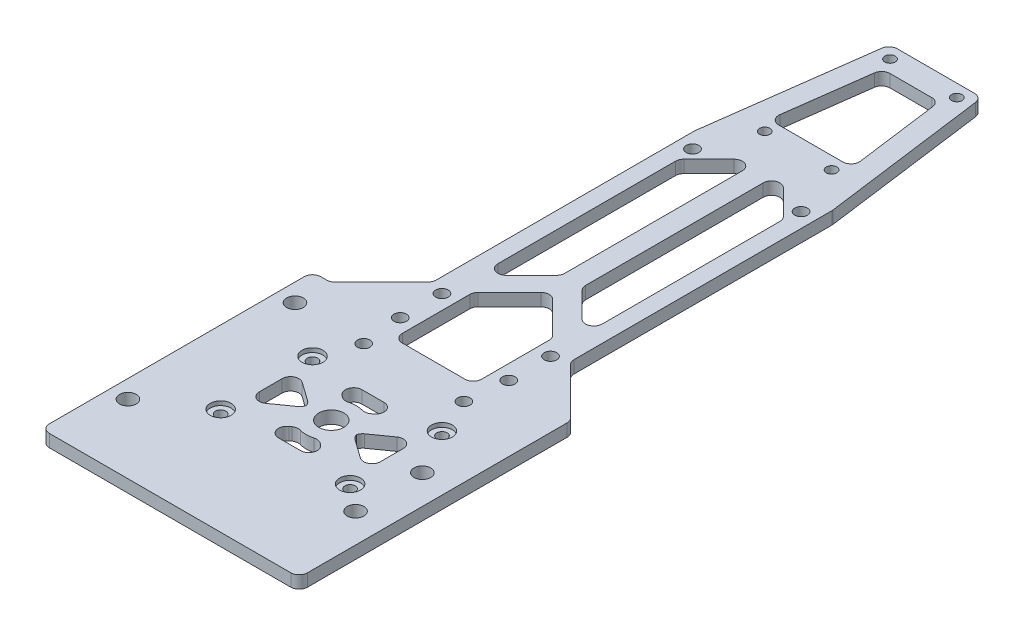
from build123d import *

# Parameters (mm, degrees)
SKETCH_1_R          = 1.25
SKETCH_1_R_2        = 1.5
EXTRUDE_1_DEPTH     = 3
CUT_EXTRUDE_1_DEPTH = 10
FILLET_1_R          = 2
SKETCH_3_R          = 2
CUT_EXTRUDE_2_DEPTH = 185.303255533
SKETCH_5_R          = 1.25
CUT_EXTRUDE_3_DEPTH = 185.303255533
SKETCH_6_R          = 3
CUT_EXTRUDE_4_DEPTH = 10
SKETCH_7_R          = 2.5
CUT_EXTRUDE_5_DEPTH = 1
FILLET_2_R          = 2
SKETCH_8_R          = 1.5
CUT_EXTRUDE_6_DEPTH = 10


with BuildPart() as part:
    # 草图1 → 凸台-拉伸1 (new body)
    with BuildSketch(Plane(origin=(0, 0, 0), x_dir=(1, 0, 0), z_dir=(0, 1, 0))):
        Polygon((11, 0), (-11, 0), (-16.5, -41.3), (-16.5, -104), (-28.8, -116.3), (-33, -116.3), (-33, -181.3), (28.8, -181.3), (28.8, -120.3), (28.8, -116.3), (16.5, -104), (16.5, -41.3), align=None)
        with Locations(Location((-8, -3, 0), (0, 0, 270))):
            Circle(SKETCH_1_R, mode=Mode.SUBTRACT)
        with Locations(Location((-8, -33, 0), (0, 0, 270))):
            Circle(SKETCH_1_R, mode=Mode.SUBTRACT)
        with Locations(Location((8, -33, 0), (0, 0, 90))):
            Circle(SKETCH_1_R, mode=Mode.SUBTRACT)
        with Locations(Location((8, -3, 0), (0, 0, 90))):
            Circle(SKETCH_1_R, mode=Mode.SUBTRACT)
        with Locations(Location((-13, -45.3, 0), (0, 0, 270))):
            Circle(SKETCH_1_R_2, mode=Mode.SUBTRACT)
        with Locations(Location((-13, -105.3, 0), (0, 0, 270))):
            Circle(SKETCH_1_R_2, mode=Mode.SUBTRACT)
        with Locations(Location((-13, -115.3, 0), (0, 0, 270))):
            Circle(SKETCH_1_R_2, mode=Mode.SUBTRACT)
        with Locations(Location((13, -115.3, 0), (0, 0, 90))):
            Circle(SKETCH_1_R_2, mode=Mode.SUBTRACT)
        with Locations(Location((13, -105.3, 0), (0, 0, 90))):
            Circle(SKETCH_1_R_2, mode=Mode.SUBTRACT)
        with Locations(Location((13, -45.3, 0), (0, 0, 90))):
            Circle(SKETCH_1_R_2, mode=Mode.SUBTRACT)
    extrude(amount=EXTRUDE_1_DEPTH)

    # 草图2 → 切除-拉伸1 (cut)
    with BuildSketch(Plane(origin=(0, 3, 0), x_dir=(1, 0, 0), z_dir=(0, 1, 0))):
        Polygon((6.754889433, -6), (-6.754889433, -6), (-9.951015341, -30), (9.951015341, -30), align=None)
        Polygon((12.5, -97.228932188), (2.5, -87.228932188), (2.5, -39.042640687), (12.5, -49.042640687), align=None)
        Polygon((-12.5, -49.042640687), (-2.5, -39.042640687), (-2.5, -87.228932188), (-12.5, -97.228932188), align=None)
        Polygon((-9.5, -101.3), (0, -91.8), (9.5, -101.3), (9.5, -120.3), (-9.5, -120.3), align=None)
    extrude(amount=-CUT_EXTRUDE_1_DEPTH, mode=Mode.SUBTRACT)

    # 圆角1
    fillet_1_edges = [part.edges().sort_by_distance(p)[0] for p in [
        (-9.951015341, 1.5, 30),
        (-6.754889433, 1.5, 6),
        (6.754889433, 1.5, 6),
        (9.951015341, 1.5, 30),
        (0, 1.5, 91.8),
        (9.5, 1.5, 101.3),
        (9.5, 1.5, 120.3),
        (-9.5, 1.5, 120.3),
        (-9.5, 1.5, 101.3),
        (12.5, 1.5, 49.042640687),
        (12.5, 1.5, 97.228932188),
        (2.5, 1.5, 87.228932188),
        (2.5, 1.5, 39.042640687),
        (-12.5, 1.5, 97.228932188),
        (-12.5, 1.5, 49.042640687),
        (-2.5, 1.5, 39.042640687),
        (-2.5, 1.5, 87.228932188),
        (-11, 1.5, 0),
        (11, 1.5, 0),
        (16.5, 1.5, 41.3),
        (16.5, 1.5, 104),
        (28.8, 1.5, 116.3),
        (28.8, 1.5, 181.3),
        (-33, 1.5, 181.3),
        (-33, 1.5, 116.3),
        (-28.8, 1.5, 116.3),
        (-16.5, 1.5, 104),
        (-16.5, 1.5, 41.3),
    ]]
    fillet(fillet_1_edges, radius=FILLET_1_R)

    # 草图3 → 切除-拉伸2 (cut, through all)
    with BuildSketch(Plane.XZ):
        with Locations(Location((-28.7, 164.8, 0), (0, 0, 270))):
            Circle(SKETCH_3_R)
        with Locations(Location((-28.7, 124.8, 0), (0, 0, 270))):
            Circle(SKETCH_3_R)
        with Locations(Location((21.8, 160.8, 0), (0, 0, 270))):
            Circle(SKETCH_3_R)
        with Locations(Location((21.8, 144.8, 0), (0, 0, 270))):
            Circle(SKETCH_3_R)
    extrude(amount=-CUT_EXTRUDE_2_DEPTH, mode=Mode.SUBTRACT)

    # 草图5 → 切除-拉伸3 (cut, through all)
    with BuildSketch(Plane(origin=(0, 3, 0), x_dir=(1, 0, 0), z_dir=(0, 1, 0))):
        with Locations(Location((15.5, -133.8, 0), (0, 0, 270))):
            Circle(SKETCH_5_R)
        with Locations(Location((-15.5, -133.8, 0), (0, 0, 270))):
            Circle(SKETCH_5_R)
        with Locations(Location((-15.5, -155.8, 0), (0, 0, 270))):
            Circle(SKETCH_5_R)
        with Locations(Location((15.5, -155.8, 0), (0, 0, 270))):
            Circle(SKETCH_5_R)
    extrude(amount=-CUT_EXTRUDE_3_DEPTH, mode=Mode.SUBTRACT)

    # 草图6 → 切除-拉伸4 (cut)
    with BuildSketch(Plane(origin=(0, 3, 0), x_dir=(1, 0, 0), z_dir=(0, 1, 0))):
        with BuildLine():
            Line((8.907296961, -134.8), (-8.907296961, -134.8))
            Line((-8.907296961, -134.8), (-2.501258408, -139.346220909))
            ThreePointArc((-2.501258408, -139.346220909), (0, -138.8), (2.501258408, -139.346220909))
            Line((2.501258408, -139.346220909), (8.907296961, -134.8))
        make_face()
        with BuildLine():
            Line((14.5, -151.411630102), (14.5, -138.188369898))
            Line((14.5, -138.188369898), (5.973740444, -144.239263777))
            ThreePointArc((5.973740444, -144.239263777), (5.993431516, -144.51932462), (6, -144.8))
            ThreePointArc((6, -144.8), (5.993431516, -145.08067538), (5.973740444, -145.360736223))
            Line((5.973740444, -145.360736223), (14.5, -151.411630102))
        make_face()
        with BuildLine():
            Line((-2.501258408, -150.253779091), (-8.907296961, -154.8))
            Line((-8.907296961, -154.8), (8.907296961, -154.8))
            Line((8.907296961, -154.8), (2.501258408, -150.253779091))
            ThreePointArc((2.501258408, -150.253779091), (0, -150.8), (-2.501258408, -150.253779091))
        make_face()
        with BuildLine():
            Line((-5.973740444, -144.239263777), (-14.5, -138.188369898))
            Line((-14.5, -138.188369898), (-14.5, -151.411630102))
            Line((-14.5, -151.411630102), (-5.973740444, -145.360736223))
            ThreePointArc((-5.973740444, -145.360736223), (-6, -144.8), (-5.973740444, -144.239263777))
        make_face()
        with Locations(Location((0, -144.8, 0), (0, 0, 270))):
            Circle(SKETCH_6_R)
    extrude(amount=-CUT_EXTRUDE_4_DEPTH, mode=Mode.SUBTRACT)

    # 草图7 → 切除-拉伸5 (cut)
    with BuildSketch(Plane(origin=(0, 3, 0), x_dir=(1, 0, 0), z_dir=(0, 1, 0))):
        with Locations(Location((15.5, -133.8, 0), (0, 0, 270))):
            Circle(SKETCH_7_R)
        with Locations(Location((-15.5, -133.8, 0), (0, 0, 270))):
            Circle(SKETCH_7_R)
        with Locations(Location((-15.5, -155.8, 0), (0, 0, 270))):
            Circle(SKETCH_7_R)
        with Locations(Location((15.5, -155.8, 0), (0, 0, 270))):
            Circle(SKETCH_7_R)
    extrude(amount=-CUT_EXTRUDE_5_DEPTH, mode=Mode.SUBTRACT)

    # 圆角2
    # the kernel refuses this fillet: 2 mm, written as the material it adds along each edge
    with BuildSketch(Plane(origin=(-2.501258408, 3, 150.253779091), x_dir=(-0.8155071447352907, 0, 0.5787470059410188), z_dir=(0, -1, 0)), Plane(origin=(5.973740444, 3, 145.360736223), x_dir=(0.8155071447351953, 0, 0.5787470059411531), z_dir=(0, -1, 0)), Plane(origin=(-5.973740444, 3, 144.239263777), x_dir=(-0.8155071447351933, 0, -0.578747005941156), z_dir=(0, -1, 0)), Plane(origin=(2.501258408, 3, 139.346220909), x_dir=(0.8155071447352105, 0, -0.5787470059411318), z_dir=(0, -1, 0))) as fillet_2_piece_1:
        with BuildLine():
            CenterArc((1.048845576, -2), FILLET_2_R, 90, 51.317812547)
            ThreePointArc((-0.512403924, -0.75), (-0.241988966, -0.384710393), (0, 0))
            Line((0, 0), (1.048845576, 0))
        make_face()
    extrude(amount=3)
    with BuildSketch(Plane(origin=(2.501258408, 3, 150.253779091), x_dir=(0.8155071447352289, 0, 0.578747005941106), z_dir=(0, -1, 0)), Plane(origin=(5.973740444, 3, 144.239263777), x_dir=(0.815507144735187, 0, -0.5787470059411648), z_dir=(0, -1, 0)), Plane(origin=(-5.973740444, 3, 145.360736223), x_dir=(-0.8155071447352036, 0, 0.5787470059411416), z_dir=(0, -1, 0)), Plane(origin=(-2.501258408, 3, 139.346220909), x_dir=(-0.8155071447352954, 0, -0.5787470059410122), z_dir=(0, -1, 0))) as fillet_2_piece_2:
        with BuildLine():
            CenterArc((1.048845576, 2), FILLET_2_R, 218.682187453, 51.317812547)
            ThreePointArc((-0.512403924, 0.75), (-0.241988966, 0.384710393), (0, 0))
            Line((0, 0), (1.048845576, 0))
        make_face()
    extrude(amount=3)
    with BuildSketch(Plane(origin=(8.907296961, 3, 154.8), x_dir=(-1, 0, 0), z_dir=(0, -1, 0)), Plane(origin=(-8.907296961, 3, 154.8), x_dir=(0.8155071447352168, 0, -0.578747005941123), z_dir=(0, -1, 0)), Plane(origin=(-8.907296961, 3, 134.8), x_dir=(1, 0, 0), z_dir=(0, -1, 0)), Plane(origin=(8.907296961, 3, 134.8), x_dir=(-0.815507144735218, 0, 0.5787470059411214), z_dir=(0, -1, 0))) as fillet_2_piece_3:
        with BuildLine():
            CenterArc((FILLET_2_R * 3.13696161898, FILLET_2_R), FILLET_2_R, 125.362461887, 144.637538113)
            Line((FILLET_2_R * 2.55821461304, FILLET_2_R * 1.81550714474), (0, 0))
            Line((0, 0), (FILLET_2_R * 3.13696161898, 0))
        make_face()
    extrude(amount=3)
    with BuildSketch(Plane(origin=(14.5, 3, 138.188369898), x_dir=(0, 0, 1), z_dir=(0, -1, 0)), Plane(origin=(14.5, 3, 151.411630102), x_dir=(-0.8155071447352171, 0, -0.5787470059411224), z_dir=(0, -1, 0)), Plane(origin=(-14.5, 3, 151.411630102), x_dir=(0, 0, -1), z_dir=(0, -1, 0)), Plane(origin=(-14.5, 3, 138.188369898), x_dir=(0.8155071447352167, 0, 0.578747005941123), z_dir=(0, -1, 0))) as fillet_2_piece_4:
        with BuildLine():
            CenterArc((FILLET_2_R * 1.93590824573, FILLET_2_R), FILLET_2_R, 144.637538113, 125.362461887)
            Line((FILLET_2_R * 1.12040110099, FILLET_2_R * 1.57874700594), (0, 0))
            Line((0, 0), (FILLET_2_R * 1.93590824573, 0))
        make_face()
    extrude(amount=3)

    # 草图8 → 切除-拉伸6 (cut)
    with BuildSketch(Plane(origin=(0, 3, 0), x_dir=(1, 0, 0), z_dir=(0, 1, 0))):
        with Locations(Location((12, -125.05, 0), (0, 0, 270))):
            Circle(SKETCH_8_R)
        with Locations(Location((-12, -125.05, 0), (0, 0, 270))):
            Circle(SKETCH_8_R)
    extrude(amount=-CUT_EXTRUDE_6_DEPTH, mode=Mode.SUBTRACT)


solid = part.part
